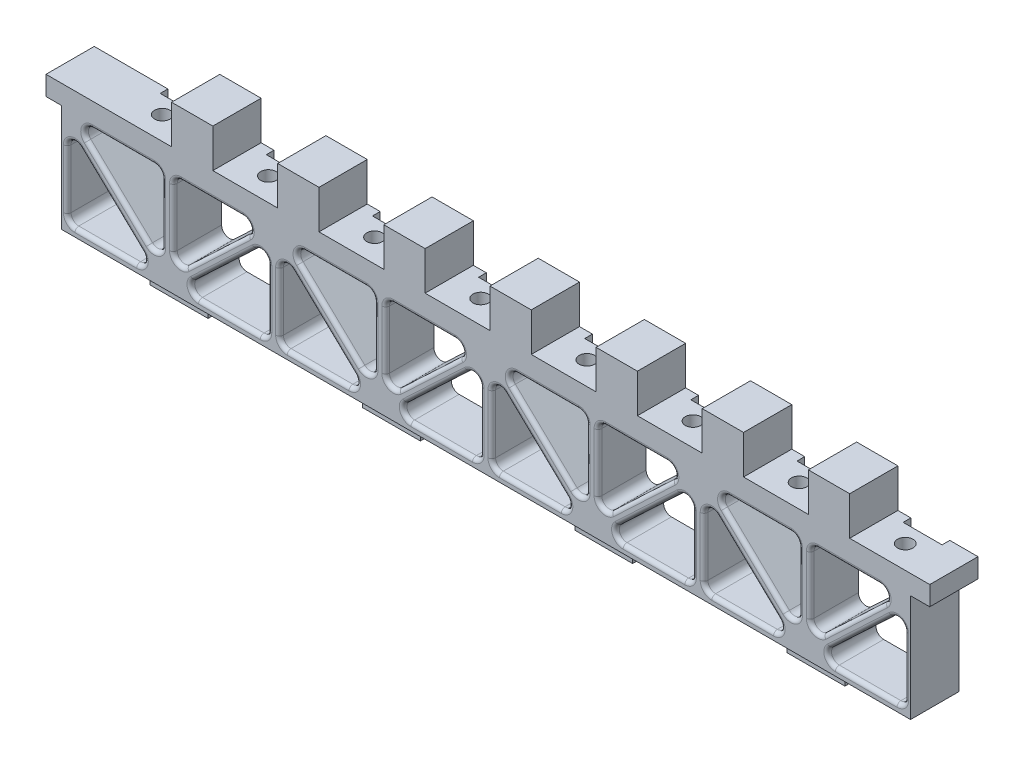
from build123d import *

# Parameters (mm, degrees)
SKETCH1_W              = 228.98
SKETCH1_H              = 12.5
BOSS_EXTRUDE1_DEPTH    = 5
SKETCH2_W              = 10.1
SKETCH2_H              = 2
CUT_EXTRUDE1_DEPTH     = 3.05
SKETCH3_R              = 2
CUT_EXTRUDE2_DEPTH     = 4
LPATTERN1_COUNT        = 8
LPATTERN1_PITCH        = 27.5
BOSS_EXTRUDE2_DEPTH    = 12.5
FILLET1_R              = 2
FILLET2_R              = 1
SKETCH5_W              = 15
SKETCH5_H              = 6.4
BOSS_EXTRUDE3_DEPTH    = 4
LPATTERN2_COUNT        = 4
LPATTERN2_PITCH        = 55
FILLET1_OF_LPATTERN2_R = 2
FILLET2_OF_LPATTERN2_R = 1
SKETCH6_W              = 10.7
SKETCH6_H              = 12.5
BOSS_EXTRUDE4_DEPTH    = 10
LPATTERN3_COUNT        = 7
LPATTERN3_PITCH        = 27.5


with BuildPart() as part:
    # Sketch1 → Boss-Extrude1 (new body)
    with BuildSketch(Plane(origin=(0, 0, 0), x_dir=(1, 0, 0), z_dir=(0, 1, 0))):
        with Locations((114.49, 6.25)):
            Rectangle(SKETCH1_W, SKETCH1_H)
    extrude(amount=BOSS_EXTRUDE1_DEPTH)

    # Sketch2 → Cut-Extrude1 (cut)
    with BuildSketch(Plane(origin=(0, 5, 0), x_dir=(1, 0, 0), z_dir=(0, 1, 0))):
        with Locations((24.13, 11.5)):
            Rectangle(SKETCH2_W, SKETCH2_H)
    cut_extrude1 = extrude(amount=-CUT_EXTRUDE1_DEPTH, mode=Mode.SUBTRACT)

    # Sketch3 → Cut-Extrude2 (cut)
    with BuildSketch(Plane(origin=(0, 5, 0), x_dir=(1, 0, 0), z_dir=(0, 1, 0))):
        with Locations((24.13, 6)):
            Circle(SKETCH3_R)
    cut_extrude2 = extrude(amount=-CUT_EXTRUDE2_DEPTH, mode=Mode.SUBTRACT)

    # LPattern1: Cut-Extrude1, Cut-Extrude2 ×8
    with Locations(*[(i * LPATTERN1_PITCH, 0, 0) for i in range(1, LPATTERN1_COUNT)]):
        add(cut_extrude1, mode=Mode.SUBTRACT)
        add(cut_extrude2, mode=Mode.SUBTRACT)

    # Sketch4 → Boss-Extrude2 (add)
    with BuildSketch(Plane.XY):
        Polygon((4, 0.20458934), (31.5, 0.20458934), (31.5, 0), (59, 0), (59, -27.79541066), (31.5, -27.79541066), (4, -27.79541066), align=None)
        Polygon((30, -1.29541066), (7, -1.29541066), (30, -23.197334449), align=None, mode=Mode.SUBTRACT)
        Polygon((5.5, -3.893486871), (5.5, -25.79541066), (28.5, -25.79541066), align=None, mode=Mode.SUBTRACT)
        Polygon((33, -1.5), (33, -23.197334449), (56, -1.5), align=None, mode=Mode.SUBTRACT)
        Polygon((34.5, -25.79541066), (57.5, -25.79541066), (57.5, -4.098076211), align=None, mode=Mode.SUBTRACT)
    boss_extrude2 = extrude(amount=-BOSS_EXTRUDE2_DEPTH)

    # Fillet1
    fillet1_edges = [part.edges().sort_by_distance(p)[0] for p in [
        (57.5, -25.79541066, -6.25),
        (57.5, -4.098076211, -6.25),
        (30, -1.29541066, -6.25),
        (33, -1.5, -6.25),
        (56, -1.5, -6.25),
        (5.5, -25.79541066, -6.25),
        (5.5, -3.893486871, -6.25),
        (7, -1.29541066, -6.25),
        (34.5, -25.79541066, -6.25),
        (28.5, -25.79541066, -6.25),
        (30, -23.197334449, -6.25),
        (33, -23.197334449, -6.25),
    ]]
    fillet(fillet1_edges, radius=FILLET1_R)

    # Fillet2
    fillet2_edges = [part.edges().sort_by_distance(p)[0] for p in [
        (25.356508228, -24.538131931, 0),
        (15.499765407, -25.79541066, 0),
        (6.085786438, -25.209624222, 0),
        (5.5, -16.177573605, 0),
        (6.712101925, -6.721471981, 0),
        (56.292202758, -6.897883737, 0),
        (57.5, -16.264853982, 0),
        (56.914213562, -25.209624222, 0),
        (47.517323418, -25.79541066, 0),
        (37.675934408, -24.533779205, 0),
        (34.207797242, -20.397526923, 0),
        (33, -11.030556678, 0),
        (33.585786438, -2.085786438, 0),
        (42.982676582, -1.5, 0),
        (52.824065592, -2.761631455, 0),
        (28.787898075, -20.369349339, 0),
        (18.621017969, -12.36161283, 0),
        (10.143491772, -2.55268939, 0),
        (20.000234593, -1.29541066, 0),
        (29.414213562, -1.881197098, 0),
        (16.878982031, -14.72920849, 0),
        (46.144908627, -14.81004209, 0),
        (44.355091373, -12.48536857, 0),
        (30, -10.913247715, 0),
    ]]
    fillet(fillet2_edges, radius=FILLET2_R)

    # Sketch5 → Boss-Extrude3 (add)
    with BuildSketch(Plane.XZ.offset(27.79541066)):
        with Locations((31.5, -6.2)):
            Rectangle(SKETCH5_W, SKETCH5_H)
    boss_extrude3 = extrude(amount=BOSS_EXTRUDE3_DEPTH)

    # LPattern2: Boss-Extrude2, Boss-Extrude3 ×4
    with Locations(*[(i * LPATTERN2_PITCH, 0, 0) for i in range(1, LPATTERN2_COUNT)]):
        add(boss_extrude2)
        add(boss_extrude3)

    # Fillet1 of LPattern2
    fillet1_of_lpattern2_edges = [part.edges().sort_by_distance(p)[0] for p in [
        (112.5, -25.79541066, -6.25),
        (112.5, -4.098076211, -6.25),
        (85, -1.29541066, -6.25),
        (88, -1.5, -6.25),
        (111, -1.5, -6.25),
        (60.5, -25.79541066, -6.25),
        (60.5, -3.893486871, -6.25),
        (62, -1.29541066, -6.25),
        (89.5, -25.79541066, -6.25),
        (83.5, -25.79541066, -6.25),
        (85, -23.197334449, -6.25),
        (88, -23.197334449, -6.25),
        (167.5, -25.79541066, -6.25),
        (167.5, -4.098076211, -6.25),
        (140, -1.29541066, -6.25),
        (143, -1.5, -6.25),
        (166, -1.5, -6.25),
        (115.5, -25.79541066, -6.25),
        (115.5, -3.893486871, -6.25),
        (117, -1.29541066, -6.25),
        (144.5, -25.79541066, -6.25),
        (138.5, -25.79541066, -6.25),
        (140, -23.197334449, -6.25),
        (143, -23.197334449, -6.25),
        (222.5, -25.79541066, -6.25),
        (222.5, -4.098076211, -6.25),
        (195, -1.29541066, -6.25),
        (198, -1.5, -6.25),
        (221, -1.5, -6.25),
        (170.5, -25.79541066, -6.25),
        (170.5, -3.893486871, -6.25),
        (172, -1.29541066, -6.25),
        (199.5, -25.79541066, -6.25),
        (193.5, -25.79541066, -6.25),
        (195, -23.197334449, -6.25),
        (198, -23.197334449, -6.25),
    ]]
    fillet(fillet1_of_lpattern2_edges, radius=FILLET1_OF_LPATTERN2_R)

    # Fillet2 of LPattern2
    fillet2_of_lpattern2_edges = [part.edges().sort_by_distance(p)[0] for p in [
        (80.356508228, -24.538131931, 0),
        (70.499765407, -25.79541066, 0),
        (61.085786438, -25.209624222, 0),
        (60.5, -16.177573605, 0),
        (61.712101925, -6.721471981, 0),
        (111.292202758, -6.897883737, 0),
        (112.5, -16.264853982, 0),
        (111.914213562, -25.209624222, 0),
        (102.517323418, -25.79541066, 0),
        (92.675934408, -24.533779205, 0),
        (89.207797242, -20.397526923, 0),
        (88, -11.030556678, 0),
        (88.585786438, -2.085786438, 0),
        (97.982676582, -1.5, 0),
        (107.824065592, -2.761631455, 0),
        (83.787898075, -20.369349339, 0),
        (73.621017969, -12.36161283, 0),
        (65.143491772, -2.55268939, 0),
        (75.000234593, -1.29541066, 0),
        (84.414213562, -1.881197098, 0),
        (71.878982031, -14.72920849, 0),
        (101.144908627, -14.81004209, 0),
        (99.355091373, -12.48536857, 0),
        (85, -10.913247715, 0),
        (135.356508228, -24.538131931, 0),
        (125.499765407, -25.79541066, 0),
        (116.085786438, -25.209624222, 0),
        (115.5, -16.177573605, 0),
        (116.712101925, -6.721471981, 0),
        (166.292202758, -6.897883737, 0),
        (167.5, -16.264853982, 0),
        (166.914213562, -25.209624222, 0),
        (157.517323418, -25.79541066, 0),
        (147.675934408, -24.533779205, 0),
        (144.207797242, -20.397526923, 0),
        (143, -11.030556678, 0),
        (143.585786438, -2.085786438, 0),
        (152.982676582, -1.5, 0),
        (162.824065592, -2.761631455, 0),
        (138.787898075, -20.369349339, 0),
        (128.621017969, -12.36161283, 0),
        (120.143491772, -2.55268939, 0),
        (130.000234593, -1.29541066, 0),
        (139.414213562, -1.881197098, 0),
        (126.878982031, -14.72920849, 0),
        (156.144908627, -14.81004209, 0),
        (154.355091373, -12.48536857, 0),
        (140, -10.913247715, 0),
        (190.356508228, -24.538131931, 0),
        (180.499765407, -25.79541066, 0),
        (171.085786438, -25.209624222, 0),
        (170.5, -16.177573605, 0),
        (171.712101925, -6.721471981, 0),
        (221.292202758, -6.897883737, 0),
        (222.5, -16.264853982, 0),
        (221.914213562, -25.209624222, 0),
        (212.517323418, -25.79541066, 0),
        (202.675934408, -24.533779205, 0),
        (199.207797242, -20.397526923, 0),
        (198, -11.030556678, 0),
        (198.585786438, -2.085786438, 0),
        (207.982676582, -1.5, 0),
        (217.824065592, -2.761631455, 0),
        (193.787898075, -20.369349339, 0),
        (183.621017969, -12.36161283, 0),
        (175.143491772, -2.55268939, 0),
        (185.000234593, -1.29541066, 0),
        (194.414213562, -1.881197098, 0),
        (181.878982031, -14.72920849, 0),
        (211.144908627, -14.81004209, 0),
        (209.355091373, -12.48536857, 0),
        (195, -10.913247715, 0),
    ]]
    fillet(fillet2_of_lpattern2_edges, radius=FILLET2_OF_LPATTERN2_R)

    # Sketch6 → Boss-Extrude4 (add)
    with BuildSketch(Plane(origin=(0, 5, 0), x_dir=(1, 0, 0), z_dir=(0, 1, 0))):
        with Locations((37.88, 6.25)):
            Rectangle(SKETCH6_W, SKETCH6_H)
    boss_extrude4 = extrude(amount=BOSS_EXTRUDE4_DEPTH)

    # LPattern3: Boss-Extrude4 ×7
    with Locations(*[(i * LPATTERN3_PITCH, 0, 0) for i in range(1, LPATTERN3_COUNT)]):
        add(boss_extrude4)


solid = part.part
